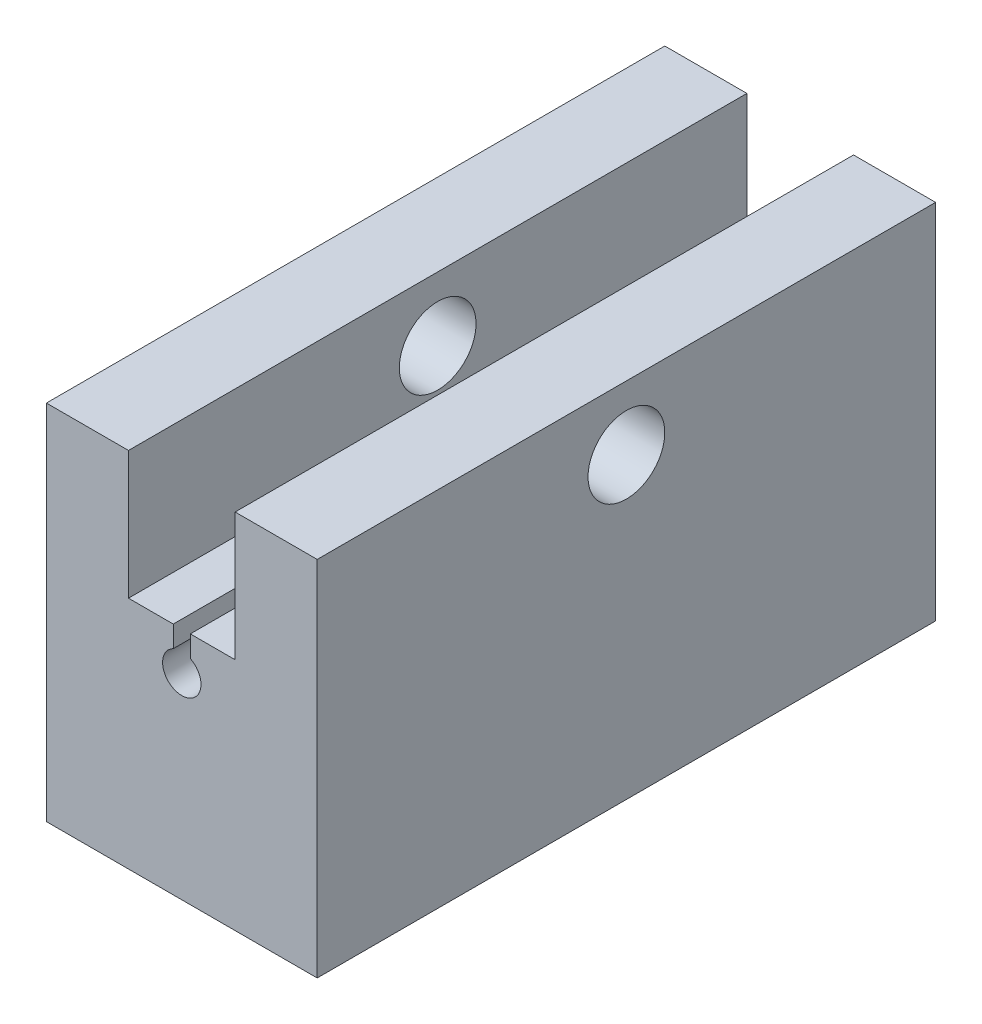
from build123d import *

# Parameters (mm, degrees)
SKETCH1_W            = 12.7
SKETCH1_H            = 29
BOSS_EXTRUDE1_DEPTH  = 7
HOLE1_D              = 5.6
HOLE1_CBORE_D        = 6
HOLE1_CBORE_DEPTH    = 6
SKETCH4_W            = 29
SKETCH4_H            = 10
BOSS_EXTRUDE2_DEPTH  = 12.7
CUT_EXTRUDE1_DEPTH   = 35.209976615
M3_CLEARANCE_HOLE1_D = 3.6
CHAMFER1_SIZE        = 6
CHAMFER1_SIZE_2      = 0.2


with BuildPart() as part:
    # Sketch1 → Boss-Extrude1 (new body)
    with BuildSketch(Plane(origin=(0, 0, 0), x_dir=(1, 0, 0), z_dir=(0, 1, 0))):
        Rectangle(SKETCH1_W, SKETCH1_H)
    extrude(amount=BOSS_EXTRUDE1_DEPTH)

    # Hole1 (through all)
    with Locations(Plane(origin=(0, 0, 0), x_dir=(-1, 0, 0), z_dir=(0, -1, 0))):
        with Locations((0, -7.5), (0, 7.5)):
            CounterBoreHole(HOLE1_D / 2, HOLE1_CBORE_D / 2, HOLE1_CBORE_DEPTH)

    # Sketch4 → Boss-Extrude2 (add)
    with BuildSketch(Plane.ZY.offset(6.35)):
        with Locations((0, 12)):
            Rectangle(SKETCH4_W, SKETCH4_H)
    extrude(amount=-BOSS_EXTRUDE2_DEPTH)

    # Sketch5 → Cut-Extrude1 (cut, through all)
    with BuildSketch(Plane(origin=(0, 0, -14.5), x_dir=(-1, 0, 0), z_dir=(0, 0, -1))):
        with BuildLine():
            Line((-0.4, 11), (-0.4, 10))
            ThreePointArc((-0.4, 10), (0, 8.293774225), (0.4, 10))
            Line((0.4, 10), (0.4, 11))
            Line((0.4, 11), (2.5, 11))
            Line((2.5, 11), (2.5, 17))
            Line((2.5, 17), (-2.5, 17))
            Line((-2.5, 17), (-2.5, 11))
            Line((-2.5, 11), (-0.4, 11))
        make_face()
    extrude(amount=-CUT_EXTRUDE1_DEPTH, mode=Mode.SUBTRACT)

    # M3 Clearance Hole1 (through all)
    with Locations(Plane.ZY.offset(6.35)):
        with Locations((0, 14)):
            Hole(M3_CLEARANCE_HOLE1_D / 2)

    # Chamfer1
    # the kernel refuses this chamfer: 6, 0.2 mm, written as the material it adds along each edge
    with BuildSketch(Plane(origin=(0, 6, -7.5), x_dir=(-1, 0, 0), z_dir=(0, 0, 1))) as chamfer1_piece_1_section:
        Polygon((3, CHAMFER1_SIZE), (3 - CHAMFER1_SIZE_2, 0), (3, 0), align=None)
    chamfer1_piece_1 = revolve(axis=Axis((0, 6, -7.5), (0, -1, 0)), mode=Mode.PRIVATE)
    chamfer1_piece_1 = split(chamfer1_piece_1, bisect_by=Plane(origin=(2.92947192, 0, -7.5), z_dir=(0, 1, 0)), keep=Keep.TOP, mode=Mode.PRIVATE)
    chamfer1_piece_1 = chamfer1_piece_1 - Plane(origin=(0, 3.000982397, -7.5), x_dir=(1, 0, 0), z_dir=(0, 1, 0)) * Cylinder(2.8, 24, mode=Mode.PRIVATE)
    add(chamfer1_piece_1)
    with BuildSketch(Plane(origin=(0, 6, 7.5), x_dir=(-1, 0, 0), z_dir=(0, 0, 1))) as chamfer1_piece_2_section:
        Polygon((3, CHAMFER1_SIZE), (3 - CHAMFER1_SIZE_2, 0), (3, 0), align=None)
    chamfer1_piece_2 = revolve(axis=Axis((0, 6, 7.5), (0, -1, 0)), mode=Mode.PRIVATE)
    chamfer1_piece_2 = split(chamfer1_piece_2, bisect_by=Plane(origin=(2.92947192, 0, 7.5), z_dir=(0, 1, 0)), keep=Keep.TOP, mode=Mode.PRIVATE)
    chamfer1_piece_2 = chamfer1_piece_2 - Plane(origin=(0, 3.000982397, 7.5), x_dir=(1, 0, 0), z_dir=(0, 1, 0)) * Cylinder(2.8, 24, mode=Mode.PRIVATE)
    add(chamfer1_piece_2)


solid = part.part
